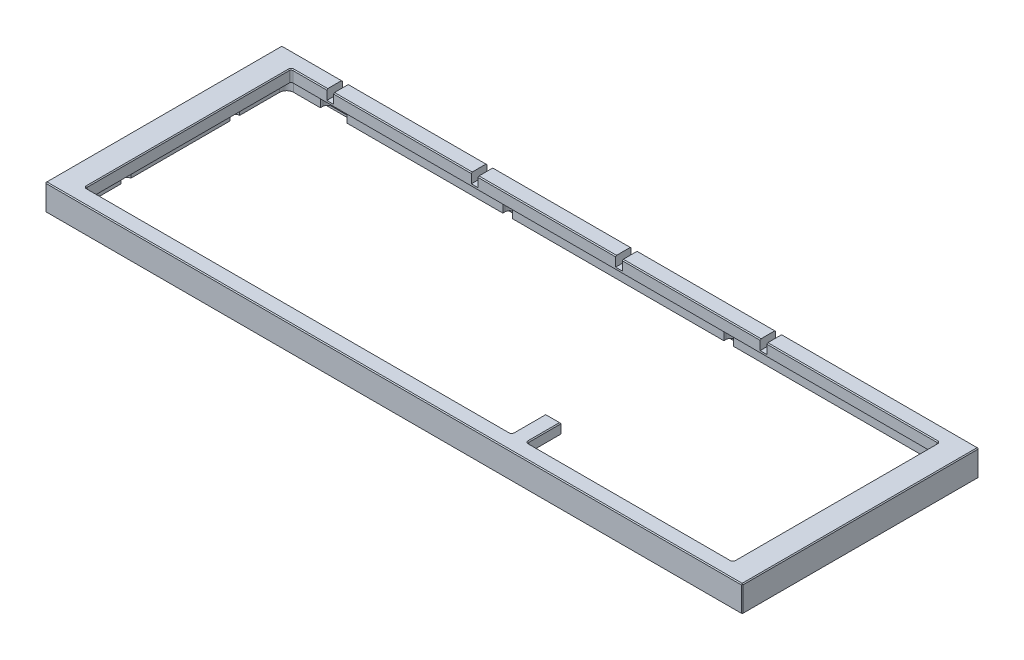
from build123d import *

# Parameters (mm, degrees)
SKETCH1_W                 = 390.74
SKETCH1_H                 = 132.7
SKETCH1_W_2               = 362.9
SKETCH1_H_2               = 115.3
MAIN_BODY_DEPTH           = 14.8
SKETCH2_W                 = 386.74
SKETCH2_H                 = 128.7
ALIGNMENT_GUIDE_DEPTH     = 2
SKETCH3_W                 = 8.7
SKETCH3_H                 = 19.1
SKETCH3_W_2               = 3.8
BLOCKERS_DEPTH            = 5.5
FILLET5_R                 = 1
SKETCH4_W                 = 371.8
SKETCH4_H                 = 119.1
PCB_CUTOUT_DEPTH          = 6.3
FILLET4_R                 = 4
PLATETABS_DEPTH           = 6.3
SKETCH9_W                 = 10
SKETCH9_H                 = 3.8
USB_CUTOUT_DEPTH          = 8.7
SKETCH10_W                = 14
SKETCH10_H                = 7.8
USB_OUTLINE_DEPTH         = 1
SKETCH11_W                = 15
SKETCH11_H                = 4.8
PCB_CLEARANCE_DEPTH       = 3.9
FILLET6_R                 = 1.5
FILLET7_R                 = 2.5
CHAMFER1_SIZE             = 0.5
CHAMFER2_SIZE             = 0.5
M3X0_5_TAPPED_HOLE1_D     = 2.5
M3X0_5_TAPPED_HOLE1_DEPTH = 4
M3X0_5_TAPPED_HOLE1_TIP   = 0.751075774
M2X0_4_TAPPED_HOLE4_D     = 1.6
M2X0_4_TAPPED_HOLE4_DEPTH = 4
M2X0_4_TAPPED_HOLE4_TIP   = 0.480688495
SKETCH32_W                = 3.8
SKETCH32_H                = 27.8
CUT_EXTRUDE13_DEPTH       = 5.5


with BuildPart() as part:
    # Sketch1 → Main Body (new body)
    with BuildSketch(Plane(origin=(0, 0, 0), x_dir=(1, 0, 0), z_dir=(0, 1, 0))):
        with Locations((195.37, 66.35)):
            Rectangle(SKETCH1_W, SKETCH1_H)
        with Locations((195.37, 66.35)):
            Rectangle(SKETCH1_W_2, SKETCH1_H_2, mode=Mode.SUBTRACT)
    extrude(amount=MAIN_BODY_DEPTH)

    # Sketch2 → Alignment Guide (cut)
    with BuildSketch(Plane.XZ):
        with Locations((195.37, -66.35)):
            Rectangle(SKETCH2_W, SKETCH2_H)
    extrude(amount=-ALIGNMENT_GUIDE_DEPTH, mode=Mode.SUBTRACT)

    # Sketch3 → Blockers (add)
    with BuildSketch(Plane(origin=(0, 14.8, 0), x_dir=(1, 0, 0), z_dir=(0, 1, 0))):
        with Locations((257.17, 18.25)):
            Rectangle(SKETCH3_W, SKETCH3_H)
        with Locations((35.82, 114.45)):
            Rectangle(SKETCH3_W_2, SKETCH3_H)
        with Locations((116.82, 114.45)):
            Rectangle(SKETCH3_W_2, SKETCH3_H)
        with Locations((197.72, 114.45)):
            Rectangle(SKETCH3_W_2, SKETCH3_H)
        with Locations((278.72, 114.45)):
            Rectangle(SKETCH3_W_2, SKETCH3_H)
    extrude(amount=-BLOCKERS_DEPTH)

    # Fillet5
    fillet5_edges = [part.edges().sort_by_distance(p)[0] for p in [
        (13.92, 8.4, -124),
        (13.92, 8.4, -8.7),
        (376.82, 8.4, -8.7),
        (376.82, 8.4, -124),
        (252.82, 12.05, -8.7),
        (261.52, 12.05, -8.7),
    ]]
    fillet(fillet5_edges, radius=FILLET5_R)

    # Sketch4 → PCB Cutout (cut)
    with BuildSketch(Plane.XZ.offset(-2)):
        with Locations((195.37, -66.35)):
            Rectangle(SKETCH4_W, SKETCH4_H)
    extrude(amount=-PCB_CUTOUT_DEPTH, mode=Mode.SUBTRACT)

    # Fillet4
    fillet4_edges = [part.edges().sort_by_distance(p)[0] for p in [
        (381.27, 5.15, -6.8),
        (381.27, 5.15, -125.9),
        (9.47, 5.15, -125.9),
        (9.47, 5.15, -6.8),
        (2, 1, -2),
        (388.74, 1, -2),
        (388.74, 1, -130.7),
        (2, 1, -130.7),
    ]]
    fillet(fillet4_edges, radius=FILLET4_R)

    # Sketch6 → PlateTabs (cut)
    with BuildSketch(Plane.XZ.offset(-2)):
        with BuildLine():
            ThreePointArc((381.27, -99.59271763), (383.084013406, -98.722498331), (383.82, -96.85))
            ThreePointArc((383.82, -96.85), (383.084013406, -94.977501669), (381.27, -94.10728237))
            Line((381.27, -94.10728237), (381.27, -99.59271763))
        make_face()
        with BuildLine():
            Line((381.27, -99.59271763), (381.27, -94.10728237))
            ThreePointArc((381.27, -94.10728237), (378.32, -96.85), (381.27, -99.59271763))
        make_face()
        with BuildLine():
            ThreePointArc((381.27, -33.10728237), (378.32, -35.85), (381.27, -38.59271763))
            Line((381.27, -38.59271763), (381.27, -33.10728237))
        make_face()
        with BuildLine():
            Line((381.27, -33.10728237), (381.27, -38.59271763))
            ThreePointArc((381.27, -38.59271763), (383.084013406, -37.722498331), (383.82, -35.85))
            ThreePointArc((383.82, -35.85), (383.084013406, -33.977501669), (381.27, -33.10728237))
        make_face()
        with BuildLine():
            Line((254.59, -6.8), (255.452541391, -6.8))
            ThreePointArc((255.452541391, -6.8), (254.814825632, -5.889033706), (254.59, -4.8))
            Line((254.59, -4.8), (254.59, -6.8))
        make_face()
        with BuildLine():
            Line((255.452541391, -6.8), (259.227458609, -6.8))
            ThreePointArc((259.227458609, -6.8), (259.865174368, -5.889033706), (260.09, -4.8))
            Line((260.09, -4.8), (254.59, -4.8))
            ThreePointArc((254.59, -4.8), (254.814825632, -5.889033706), (255.452541391, -6.8))
        make_face()
        with BuildLine():
            Line((259.227458609, -6.8), (260.09, -6.8))
            Line((260.09, -6.8), (260.09, -4.8))
            ThreePointArc((260.09, -4.8), (259.865174368, -5.889033706), (259.227458609, -6.8))
        make_face()
        with BuildLine():
            Line((254.59, -4.8), (260.09, -4.8))
            ThreePointArc((260.09, -4.8), (257.34, -2.05), (254.59, -4.8))
        make_face()
        with BuildLine():
            Line((260.09, -127.1), (254.59, -127.1))
            ThreePointArc((254.59, -127.1), (257.34, -129.85), (260.09, -127.1))
        make_face()
        with BuildLine():
            ThreePointArc((254.865631394, -125.9), (254.659793509, -126.484375791), (254.59, -127.1))
            Line((254.59, -127.1), (260.09, -127.1))
            ThreePointArc((260.09, -127.1), (260.020206491, -126.484375791), (259.814368606, -125.9))
            Line((259.814368606, -125.9), (254.865631394, -125.9))
        make_face()
        with BuildLine():
            Line((254.59, -125.9), (254.59, -127.1))
            ThreePointArc((254.59, -127.1), (254.659793509, -126.484375791), (254.865631394, -125.9))
            Line((254.865631394, -125.9), (254.59, -125.9))
        make_face()
        with BuildLine():
            ThreePointArc((130.65, -127.1), (133.4, -129.85), (136.15, -127.1))
            Line((136.15, -127.1), (130.65, -127.1))
        make_face()
        with BuildLine():
            ThreePointArc((136.15, -127.1), (136.080206491, -126.484375791), (135.874368606, -125.9))
            Line((135.874368606, -125.9), (130.925631394, -125.9))
            ThreePointArc((130.925631394, -125.9), (130.719793509, -126.484375791), (130.65, -127.1))
            Line((130.65, -127.1), (136.15, -127.1))
        make_face()
        with BuildLine():
            ThreePointArc((12.42, -96.85), (11.542498331, -94.835986594), (9.47, -94.10728237))
            Line((9.47, -94.10728237), (9.47, -99.59271763))
            ThreePointArc((9.47, -99.59271763), (11.542498331, -98.864013406), (12.42, -96.85))
        make_face()
        with BuildLine():
            Line((9.47, -99.59271763), (9.47, -94.10728237))
            ThreePointArc((9.47, -94.10728237), (6.92, -96.85), (9.47, -99.59271763))
        make_face()
        with BuildLine():
            ThreePointArc((9.47, -38.59271763), (11.542498331, -37.864013406), (12.42, -35.85))
            ThreePointArc((12.42, -35.85), (11.542498331, -33.835986594), (9.47, -33.10728237))
            Line((9.47, -33.10728237), (9.47, -38.59271763))
        make_face()
        with BuildLine():
            Line((9.47, -38.59271763), (9.47, -33.10728237))
            ThreePointArc((9.47, -33.10728237), (6.92, -35.85), (9.47, -38.59271763))
        make_face()
        with BuildLine():
            Line((130.65, -4.8), (136.15, -4.8))
            ThreePointArc((136.15, -4.8), (133.4, -2.05), (130.65, -4.8))
        make_face()
        with BuildLine():
            ThreePointArc((135.287458609, -6.8), (135.925174368, -5.889033706), (136.15, -4.8))
            Line((136.15, -4.8), (130.65, -4.8))
            ThreePointArc((130.65, -4.8), (130.874825632, -5.889033706), (131.512541391, -6.8))
            Line((131.512541391, -6.8), (135.287458609, -6.8))
        make_face()
        with BuildLine():
            ThreePointArc((259.814368606, -125.9), (260.020206491, -126.484375791), (260.09, -127.1))
            Line((260.09, -127.1), (260.09, -125.9))
            Line((260.09, -125.9), (259.814368606, -125.9))
        make_face()
        with BuildLine():
            ThreePointArc((131.512541391, -6.8), (130.874825632, -5.889033706), (130.65, -4.8))
            Line((130.65, -4.8), (130.65, -6.8))
            Line((130.65, -6.8), (131.512541391, -6.8))
        make_face()
        with BuildLine():
            Line((135.287458609, -6.8), (136.15, -6.8))
            Line((136.15, -6.8), (136.15, -4.8))
            ThreePointArc((136.15, -4.8), (135.925174368, -5.889033706), (135.287458609, -6.8))
        make_face()
        with BuildLine():
            Line((136.15, -127.1), (136.15, -125.9))
            Line((136.15, -125.9), (135.874368606, -125.9))
            ThreePointArc((135.874368606, -125.9), (136.080206491, -126.484375791), (136.15, -127.1))
        make_face()
        with BuildLine():
            ThreePointArc((130.65, -127.1), (130.719793509, -126.484375791), (130.925631394, -125.9))
            Line((130.925631394, -125.9), (130.65, -125.9))
            Line((130.65, -125.9), (130.65, -127.1))
        make_face()
    extrude(amount=-PLATETABS_DEPTH, mode=Mode.SUBTRACT)

    # Sketch9 → USB Cutout (cut)
    with BuildSketch(Plane(origin=(0, 0, -132.7), x_dir=(-1, 0, 0), z_dir=(0, 0, -1))):
        with Locations((-35.9, 4.9)):
            Rectangle(SKETCH9_W, SKETCH9_H)
    extrude(amount=-USB_CUTOUT_DEPTH, mode=Mode.SUBTRACT)

    # Sketch10 → USB Outline (cut)
    with BuildSketch(Plane(origin=(0, 0, -132.7), x_dir=(-1, 0, 0), z_dir=(0, 0, -1))):
        with Locations((-35.9, 4.9)):
            Rectangle(SKETCH10_W, SKETCH10_H)
    extrude(amount=-USB_OUTLINE_DEPTH, mode=Mode.SUBTRACT)

    # Sketch11 → PCB Clearance (cut)
    with BuildSketch(Plane.XY.offset(-125.9)):
        with Locations((35.9, 4.4)):
            Rectangle(SKETCH11_W, SKETCH11_H)
    extrude(amount=-PCB_CLEARANCE_DEPTH, mode=Mode.SUBTRACT)

    # Fillet6
    fillet6_edges = [part.edges().sort_by_distance(p)[0] for p in [
        (42.9, 1, -132.2),
        (42.9, 8.8, -132.2),
        (28.9, 8.8, -132.2),
        (28.9, 1, -132.2),
        (40.9, 3, -130.75),
        (40.9, 6.8, -130.75),
        (30.9, 6.8, -130.75),
        (30.9, 3, -130.75),
    ]]
    fillet(fillet6_edges, radius=FILLET6_R)

    # Fillet7
    fillet7_edges = [part.edges().sort_by_distance(p)[0] for p in [
        (43.4, 4.4, -129.8),
        (28.4, 4.4, -129.8),
    ]]
    fillet(fillet7_edges, radius=FILLET7_R - 0.0001)  # a hair under: the kernel refuses the full size

    # Chamfer1
    chamfer1_edges = [part.edges().sort_by_distance(p)[0] for p in [
        (328.22, 14.8, -124),
        (13.92, 14.8, -66.35),
        (319.17, 14.8, -8.7),
        (133.37, 14.8, -8.7),
        (261.52, 14.8, -18.75),
        (376.82, 14.8, -66.35),
        (14.212893219, 14.8, -123.707106781),
        (14.212893219, 14.8, -8.992893219),
        (252.527106781, 14.8, -8.992893219),
        (261.812893219, 14.8, -8.992893219),
        (376.527106781, 14.8, -8.992893219),
        (390.74, 14.8, -66.35),
        (376.527106781, 14.8, -123.707106781),
        (195.37, 14.8, -132.7),
        (0, 14.8, -66.35),
        (252.82, 14.8, -18.75),
        (257.17, 14.8, -27.8),
        (24.42, 14.8, -124),
        (33.92, 14.8, -114.45),
        (35.82, 14.8, -104.9),
        (37.72, 14.8, -114.45),
        (76.32, 14.8, -124),
        (114.92, 14.8, -114.45),
        (116.82, 14.8, -104.9),
        (118.72, 14.8, -114.45),
        (157.27, 14.8, -124),
        (195.82, 14.8, -114.45),
        (197.72, 14.8, -104.9),
        (199.62, 14.8, -114.45),
        (195.37, 14.8, 0),
        (238.22, 14.8, -124),
        (276.82, 14.8, -114.45),
        (278.72, 14.8, -104.9),
        (280.62, 14.8, -114.45),
    ]]
    chamfer(chamfer1_edges, length=CHAMFER1_SIZE)

    # Chamfer2
    chamfer2_edges = [part.edges().sort_by_distance(p)[0] for p in [
        (195.37, 0, -132.7),
        (0, 7.15, -132.7),
        (390.74, 0, -66.35),
        (390.74, 7.15, -132.7),
        (390.74, 7.15, 0),
        (0, 7.15, 0),
        (195.37, 0, 0),
        (0, 0, -66.35),
    ]]
    chamfer(chamfer2_edges, length=CHAMFER2_SIZE)

    # M3x0.5 Tapped Hole1
    with Locations(Plane(origin=(385.04, 2, -111.35), x_dir=(0, 0, -1), z_dir=(0, -1, 0))):
        with Locations((0, 0), (-90, 0), (-106.95, -104.3), (-106.95, -275.04), (-90, -379.34), (-45, -379.34), (0, -379.34), (16.95, -275.04), (16.95, -104.3), (-45, 0)):
            Hole(M3X0_5_TAPPED_HOLE1_D / 2, depth=M3X0_5_TAPPED_HOLE1_DEPTH)
            with Locations((0, 0, -(M3X0_5_TAPPED_HOLE1_DEPTH + M3X0_5_TAPPED_HOLE1_TIP / 2))):  # 118° drill point
                Cone(0, M3X0_5_TAPPED_HOLE1_D / 2, M3X0_5_TAPPED_HOLE1_TIP, mode=Mode.SUBTRACT)

    # M2x0.4 Tapped Hole4
    with Locations(Plane(origin=(381.07, 8.3, -96.85), x_dir=(0, 0, -1), z_dir=(0, -1, 0))):
        with Locations((0, 0), (-61, 0), (-92.05, -123.73), (-92.05, -247.67), (-61, -371.4), (0, -371.4), (30.25, -247.67), (30.25, -123.73)):
            Hole(M2X0_4_TAPPED_HOLE4_D / 2, depth=M2X0_4_TAPPED_HOLE4_DEPTH)
            with Locations((0, 0, -(M2X0_4_TAPPED_HOLE4_DEPTH + M2X0_4_TAPPED_HOLE4_TIP / 2))):  # 118° drill point
                Cone(0, M2X0_4_TAPPED_HOLE4_D / 2, M2X0_4_TAPPED_HOLE4_TIP, mode=Mode.SUBTRACT)

    # Sketch32 → Cut-Extrude13 (cut)
    with BuildSketch(Plane(origin=(0, 14.8, 0), x_dir=(1, 0, 0), z_dir=(0, 1, 0))):
        with Locations((35.82, 118.8)):
            Rectangle(SKETCH32_W, SKETCH32_H)
        with Locations((116.82, 118.8)):
            Rectangle(SKETCH32_W, SKETCH32_H)
        with Locations((197.72, 118.8)):
            Rectangle(SKETCH32_W, SKETCH32_H)
        with Locations((278.72, 118.8)):
            Rectangle(SKETCH32_W, SKETCH32_H)
    extrude(amount=-CUT_EXTRUDE13_DEPTH, mode=Mode.SUBTRACT)


solid = part.part
